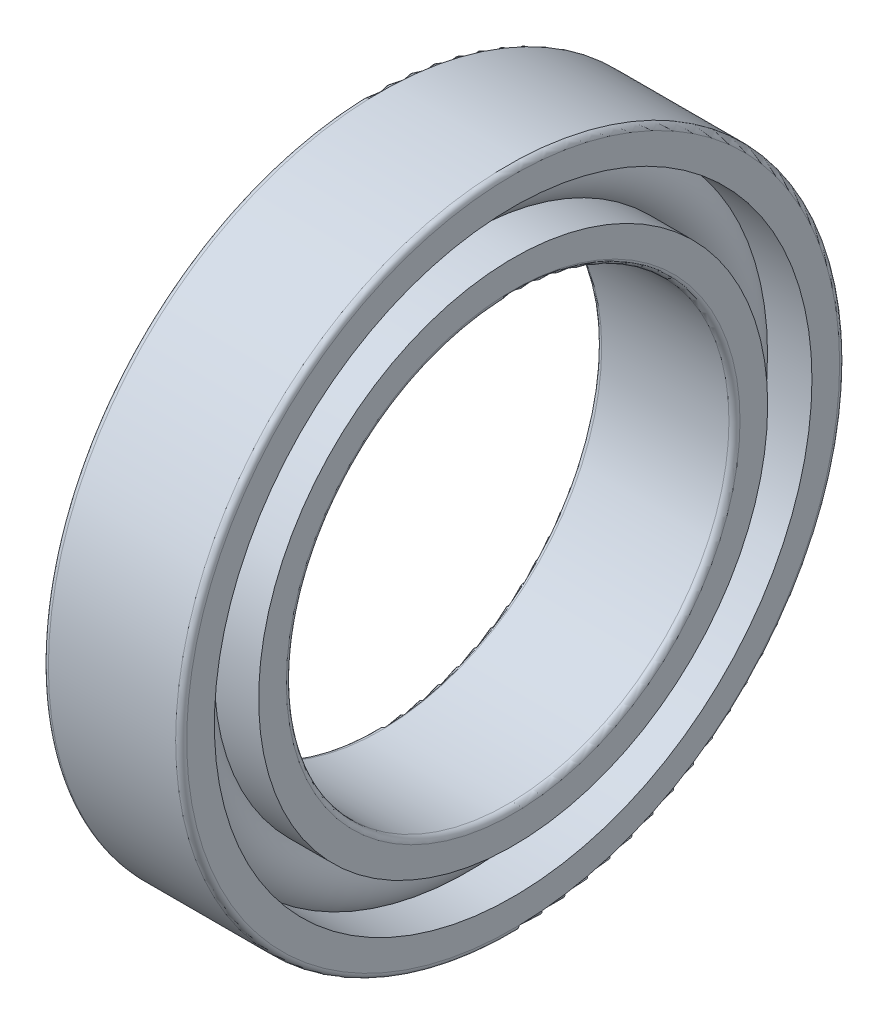
from build123d import *

# Parameters (mm, degrees)
CAGSPISKE_W     = 0.12
CAGSPISKE_H     = 0.2
CAGESPINE_ANGLE = 0.001
BALSIMSKE_R     = 0.6


with BuildPart() as part:
    # CagSpiSke → CageSpine (revolve)
    with BuildSketch(Plane.XY):
        with Locations((0, 5)):
            Rectangle(CAGSPISKE_W, CAGSPISKE_H)
    revolve(axis=Axis((-20.6375, 0, 0), (-1, 0, 0)), revolution_arc=CAGESPINE_ANGLE)

    # BalSimSke → BallsSimplified (revolve)
    with BuildSketch(Plane.XY):
        with Locations((0, 5)):
            Circle(BALSIMSKE_R)
    revolve(axis=Axis((-10, 0, 0), (1, 0, 0)))

    # InnRacSke → InnerRace (revolve)
    with BuildSketch(Plane.XY):
        with BuildLine():
            Line((-0.413067791, 4.6), (-1.25, 4.6))
            Line((-1.25, 4.6), (-1.25, 4.1))
            ThreePointArc((-1.25, 4.1), (-1.220710678, 4.029289322), (-1.15, 4))
            Line((-1.15, 4), (1.15, 4))
            ThreePointArc((1.15, 4), (1.220710678, 4.029289322), (1.25, 4.1))
            Line((1.25, 4.1), (1.25, 4.6))
            Line((1.25, 4.6), (0.413067791, 4.6))
            ThreePointArc((0.413067791, 4.6), (0, 4.425), (-0.413067791, 4.6))
        make_face()
    revolve(axis=Axis((-20.6375, 0, 0), (1, 0, 0)))

    # OutRacSke → OuterRace (revolve)
    with BuildSketch(Plane.XY):
        with BuildLine():
            Line((-0.413067791, 5.4), (-1.25, 5.4))
            Line((-1.25, 5.4), (-1.25, 5.9))
            ThreePointArc((-1.25, 5.9), (-1.220710678, 5.970710678), (-1.15, 6))
            Line((-1.15, 6), (1.15, 6))
            ThreePointArc((1.15, 6), (1.220710678, 5.970710678), (1.25, 5.9))
            Line((1.25, 5.9), (1.25, 5.4))
            Line((1.25, 5.4), (0.413067791, 5.4))
            ThreePointArc((0.413067791, 5.4), (0, 5.575), (-0.413067791, 5.4))
        make_face()
    revolve(axis=Axis((-20.6375, 0, 0), (1, 0, 0)))


solid = part.part
